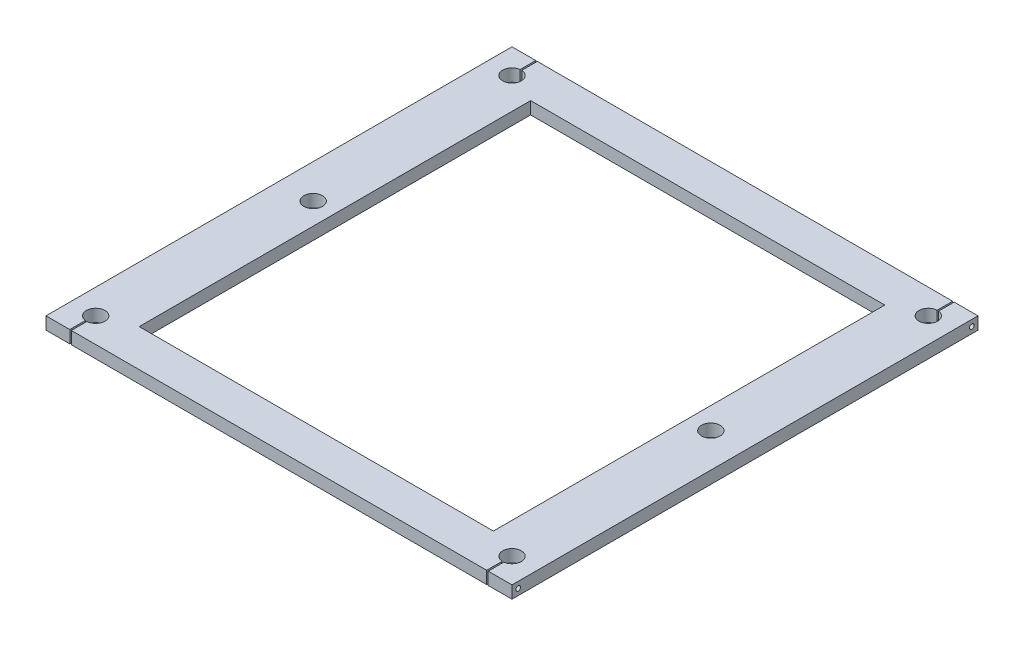
from build123d import *

# Parameters (mm, degrees)
SKETCH1_W           = 300
SKETCH1_H           = 300
SKETCH1_W_2         = 228
SKETCH1_H_2         = 252
BOSS_EXTRUDE1_DEPTH = 8
CUT_EXTRUDE1_DEPTH  = 213.282830205
CUT_EXTRUDE2_START  = -15.3
SKETCH3_R           = 1.5
CUT_EXTRUDE2_DEPTH  = 15.3
MIRROR4_START       = -151
MIRROR4_OUTLINE_R   = 1.5
MIRROR4_DEPTH       = 284.7
MIRROR4_2_OUTLINE_R = 1.5
MIRROR4_2_DEPTH     = 17.3
MIRROR4_START_2     = -1
MIRROR4_3_DEPTH     = 10
SKETCH4_R           = 6
CUT_EXTRUDE3_DEPTH  = 213.282830205


with BuildPart() as part:
    # Sketch1 → Boss-Extrude1 (new body)
    with BuildSketch(Plane(origin=(0, 0, 0), x_dir=(1, 0, 0), z_dir=(0, 1, 0))):
        Rectangle(SKETCH1_W, SKETCH1_H)
        Rectangle(SKETCH1_W_2, SKETCH1_H_2, mode=Mode.SUBTRACT)
    extrude(amount=BOSS_EXTRUDE1_DEPTH)

    # Sketch2 → Cut-Extrude1 (cut, through all)
    with BuildSketch(Plane(origin=(0, 0, 0), x_dir=(1, 0, 0), z_dir=(0, 1, 0))):
        with BuildLine():
            Line((133.7, 150), (134.7, 150))
            Line((134.7, 150), (134.7, 139.959026766))
            ThreePointArc((134.7, 139.959026766), (133.799301132, 128.003357609), (133.7, 139.992495307))
            Line((133.7, 139.992495307), (133.7, 150))
        make_face()
    cut_extrude1 = extrude(amount=CUT_EXTRUDE1_DEPTH, mode=Mode.SUBTRACT)

    # Sketch3 → Cut-Extrude2 (cut)
    with BuildSketch(Plane(origin=(150, 0, 0), x_dir=(0, 0, -1), z_dir=(1, 0, 0)).offset(CUT_EXTRUDE2_START)):
        with Locations((146, 4)):
            Circle(SKETCH3_R)
    cut_extrude2 = extrude(amount=CUT_EXTRUDE2_DEPTH, mode=Mode.SUBTRACT)

    # Mirror3: Cut-Extrude1, Cut-Extrude2 across plane
    add(cut_extrude1.mirror(Plane.XY), mode=Mode.SUBTRACT)
    add(cut_extrude2.mirror(Plane.XY), mode=Mode.SUBTRACT)

    # Mirror4: read off the stored shape, not the designer's step
    # Mirror4 outline → Mirror4 (cut)
    with BuildSketch(Plane.YZ.offset(MIRROR4_START)):
        with Locations((4, -146)):
            Circle(MIRROR4_OUTLINE_R)
    extrude(amount=MIRROR4_DEPTH, mode=Mode.SUBTRACT)

    # Mirror4 2 outline → Mirror4 2 (cut)
    with BuildSketch(Plane.YZ.offset(MIRROR4_START)):
        with Locations((4, 146)):
            Circle(MIRROR4_2_OUTLINE_R)
    extrude(amount=MIRROR4_2_DEPTH, mode=Mode.SUBTRACT)

    # Mirror4 3 outline → Mirror4 3 (cut)
    with BuildSketch(Plane(origin=(0, 0, 0), x_dir=(1, 0, 0), z_dir=(0, 1, 0)).offset(MIRROR4_START_2)):
        with BuildLine():
            ThreePointArc((-134.7, 139.959026766), (-133.799301125, 128.003357609), (-133.7, 139.992495307))
            Line((-133.7, 139.992495307), (-133.7, 150))
            Line((-133.7, 150), (-134.7, 150))
            Line((-134.7, 150), (-134.7, 139.959026766))
        make_face()
        with BuildLine():
            Line((-133.7, -150), (-133.7, -139.992495307))
            ThreePointArc((-133.7, -139.992495307), (-133.799301125, -128.003357609), (-134.7, -139.959026766))
            Line((-134.7, -139.959026766), (-134.7, -150))
            Line((-134.7, -150), (-133.7, -150))
        make_face()
    extrude(amount=MIRROR4_3_DEPTH, mode=Mode.SUBTRACT)

    # Sketch4 → Cut-Extrude3 (cut, through all)
    with BuildSketch(Plane(origin=(0, 0, 0), x_dir=(1, 0, 0), z_dir=(0, 1, 0))):
        with Locations(Location((-128, 0, 0), (0, 0, 270))):
            Circle(SKETCH4_R)
    cut_extrude3 = extrude(amount=CUT_EXTRUDE3_DEPTH, mode=Mode.SUBTRACT)

    # Mirror5: Cut-Extrude3 across plane
    add(cut_extrude3.mirror(Plane(origin=(0, 0, 0), x_dir=(0, 0, 1), z_dir=(1, 0, 0))), mode=Mode.SUBTRACT)


solid = part.part
